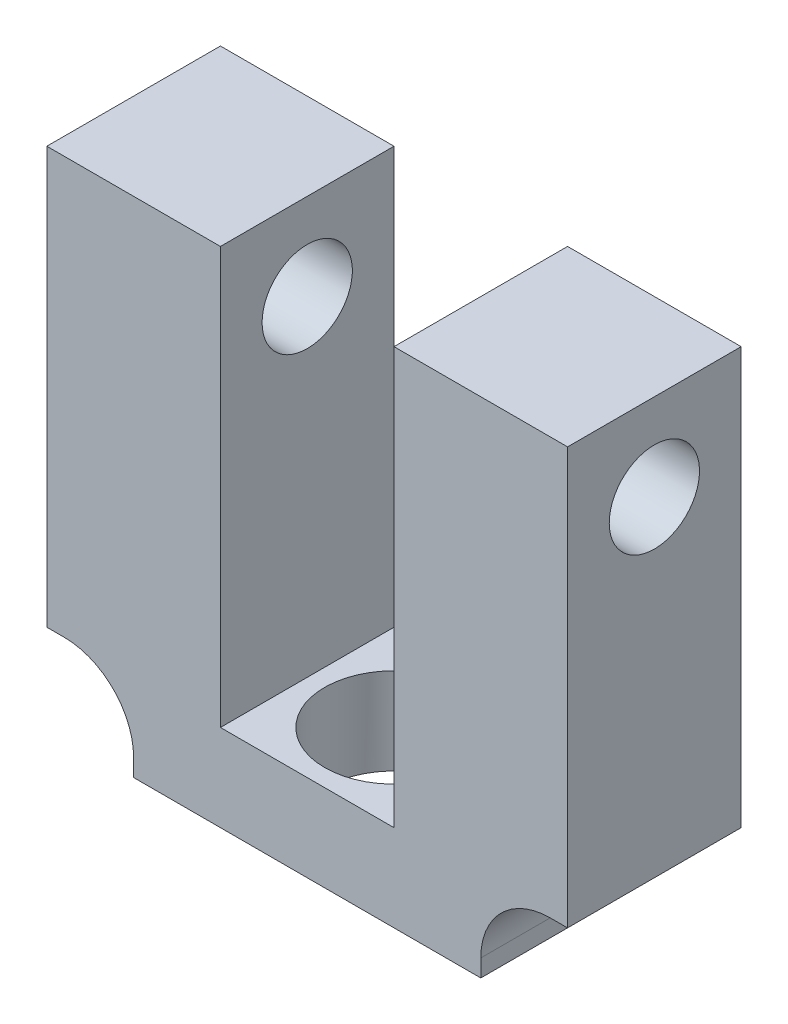
from build123d import *

# Parameters (mm, degrees)
SKETCH1_W           = 12.7
SKETCH1_H           = 6.35
BOSS_EXTRUDE1_DEPTH = 3.175
SKETCH2_W           = 6.35
SKETCH2_H           = 6.35
BOSS_EXTRUDE2_DEPTH = 15.24
FILLET1_R           = 2.54
SKETCH3_R           = 1.651
CUT_EXTRUDE1_DEPTH  = 22.606
SKETCH4_R           = 2.54
CUT_EXTRUDE2_DEPTH  = 22.606


with BuildPart() as part:
    # Sketch1 → Boss-Extrude1 (new body)
    with BuildSketch(Plane(origin=(0, 0, 0), x_dir=(1, 0, 0), z_dir=(0, 1, 0))):
        with Locations((6.35, 3.175)):
            Rectangle(SKETCH1_W, SKETCH1_H)
    extrude(amount=BOSS_EXTRUDE1_DEPTH)

    # Sketch2 → Boss-Extrude2 (add)
    with BuildSketch(Plane(origin=(0, 3.175, 0), x_dir=(1, 0, 0), z_dir=(0, 1, 0))):
        with Locations((0, 3.175)):
            Rectangle(SKETCH2_W, SKETCH2_H)
        with Locations((12.7, 3.175)):
            Rectangle(SKETCH2_W, SKETCH2_H)
    extrude(amount=BOSS_EXTRUDE2_DEPTH)

    # Fillet1
    fillet1_edges = [part.edges().sort_by_distance(p)[0] for p in [
        (12.7, 3.175, -3.175),
        (0, 3.175, -3.175),
    ]]
    fillet(fillet1_edges, radius=FILLET1_R)

    # Sketch3 → Cut-Extrude1 (cut)
    with BuildSketch(Plane.ZY.offset(3.175)):
        with Locations((-3.175, 15.24)):
            Circle(SKETCH3_R)
    extrude(amount=-CUT_EXTRUDE1_DEPTH, mode=Mode.SUBTRACT)

    # Sketch4 → Cut-Extrude2 (cut)
    with BuildSketch(Plane(origin=(0, 3.175, 0), x_dir=(1, 0, 0), z_dir=(0, 1, 0))):
        with Locations((6.35, 3.175)):
            Circle(SKETCH4_R)
    extrude(amount=-CUT_EXTRUDE2_DEPTH, mode=Mode.SUBTRACT)


solid = part.part
